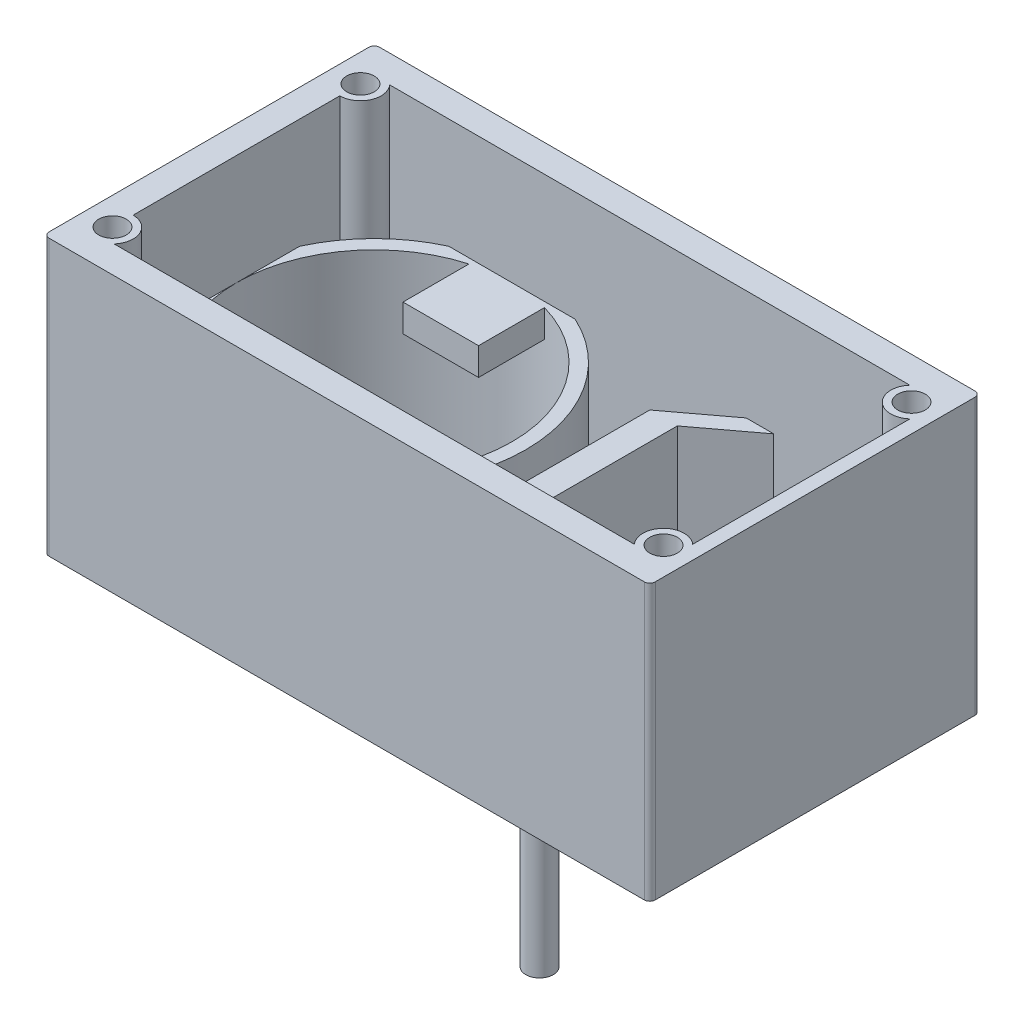
from build123d import *
from build123d.topology import SkipClean

# Parameters (mm, degrees)
SKETCH1_W                 = 22
SKETCH1_H                 = 12
BOSS_EXTRUDE1_DEPTH       = 10
SKETCH2_W                 = 20.5
SKETCH2_H                 = 10
CUT_EXTRUDE1_DEPTH        = 9
FILLET1_R                 = 0.2
SKETCH3_R                 = 5
CUT_EXTRUDE2_DEPTH        = 17.031219542
SKETCH4_R                 = 0.5
CUT_EXTRUDE3_DEPTH        = 17.031219542
SKETCH5_R                 = 2
CUT_EXTRUDE4_DEPTH        = 17.031219542
BOSS_EXTRUDE2_DEPTH       = 5
SKETCH9_R                 = 5.5
SKETCH9_R_2               = 5
BOSS_EXTRUDE3_DEPTH       = 5
SKETCH10_R                = 1
SKETCH10_R_2              = 0.5
BOSS_EXTRUDE4_DEPTH       = 2
BOSS_EXTRUDE6_START       = -1
SKETCH12_R                = 0.5
BOSS_EXTRUDE6_DEPTH       = 1
SKETCH13_R                = 0.75
SKETCH13_R_2              = 0.5
BOSS_EXTRUDE7_DEPTH       = 9
SKETCH14_R                = 0.5
CUT_EXTRUDE5_DEPTH        = 17.031219542
MIRROR2_COPY_1_SKETCH_R   = 0.75
MIRROR2_COPY_1_SKETCH_R_2 = 0.5
MIRROR2_COPY_1_DEPTH      = 9
MIRROR2_COPY_2_SKETCH_R   = 0.5
MIRROR2_COPY_2_DEPTH      = 17.031219542
MIRROR2_COPY_3_SKETCH_R   = 0.75
MIRROR2_COPY_3_SKETCH_R_2 = 0.5
MIRROR2_COPY_3_DEPTH      = 9
MIRROR2_COPY_4_SKETCH_R   = 0.5
MIRROR2_COPY_4_DEPTH      = 17.031219542
SKETCH15_W                = 2.741193842
SKETCH15_H                = 3.121519946
BOSS_EXTRUDE8_DEPTH       = 1
SKETCH16_R                = 0.5
BOSS_EXTRUDE9_DEPTH       = 10


with BuildPart() as part:
    # Sketch1 → Boss-Extrude1 (new body)
    with BuildSketch(Plane(origin=(0, 0, 0), x_dir=(1, 0, 0), z_dir=(0, 1, 0))):
        Rectangle(SKETCH1_W, SKETCH1_H)
    extrude(amount=BOSS_EXTRUDE1_DEPTH)

    # Sketch2 → Cut-Extrude1 (cut)
    with BuildSketch(Plane(origin=(0, 10, 0), x_dir=(1, 0, 0), z_dir=(0, 1, 0))):
        with Locations((0.25, 0)):
            Rectangle(SKETCH2_W, SKETCH2_H)
    extrude(amount=-CUT_EXTRUDE1_DEPTH, mode=Mode.SUBTRACT)

    # Fillet1
    fillet1_edges = [part.edges().sort_by_distance(p)[0] for p in [
        (-11, 5, -6),
        (11, 5, -6),
        (11, 5, 6),
        (-11, 5, 6),
    ]]
    fillet(fillet1_edges, radius=FILLET1_R)

    # Sketch3 → Cut-Extrude2 (cut, through all)
    with BuildSketch(Plane(origin=(0, 0, 0), x_dir=(-1, 0, 0), z_dir=(0, -1, 0))):
        with Locations((5, 0)):
            Circle(SKETCH3_R)
    extrude(amount=-CUT_EXTRUDE2_DEPTH, mode=Mode.SUBTRACT)

    # Sketch4 → Cut-Extrude3 (cut, through all)
    with BuildSketch(Plane(origin=(0, 0, 0), x_dir=(-1, 0, 0), z_dir=(0, -1, 0))):
        with Locations((-1, 0)):
            Circle(SKETCH4_R)
    extrude(amount=-CUT_EXTRUDE3_DEPTH, mode=Mode.SUBTRACT)

    # Sketch5 → Cut-Extrude4 (cut, through all)
    with BuildSketch(Plane(origin=(0, 0, 0), x_dir=(-1, 0, 0), z_dir=(0, -1, 0))):
        with Locations((-6.5, 0)):
            Circle(SKETCH5_R)
    extrude(amount=-CUT_EXTRUDE4_DEPTH, mode=Mode.SUBTRACT)

    # Sketch6 → Boss-Extrude2 (add)
    with BuildSketch(Plane(origin=(0, 1, 0), x_dir=(1, 0, 0), z_dir=(0, 1, 0))):
        Polygon((2.5, -3.5), (2.5, 3.5), (4.5, 5), (3.5, 5), (1.5, 3.5), (1.5, -3.5), (3.5, -5), (4.5, -5), align=None)
    extrude(amount=BOSS_EXTRUDE2_DEPTH)

    # Sketch9 → Boss-Extrude3 (add)
    with SkipClean():  # the faces are left unmerged after this step: merging them gives an invalid solid
        with BuildSketch(Plane(origin=(0, 1, 0), x_dir=(1, 0, 0), z_dir=(0, 1, 0))):
            with Locations((-5, 0)):
                Circle(SKETCH9_R)
            with Locations((-5, 0)):
                Circle(SKETCH9_R_2, mode=Mode.SUBTRACT)
        extrude(amount=BOSS_EXTRUDE3_DEPTH)

    # Sketch10 → Boss-Extrude4 (add)
    with SkipClean():  # the faces are left unmerged after this step: merging them gives an invalid solid
        with BuildSketch(Plane(origin=(0, 1, 0), x_dir=(1, 0, 0), z_dir=(0, 1, 0))):
            with Locations((1, 0)):
                Circle(SKETCH10_R)
            with Locations((1, 0)):
                Circle(SKETCH10_R_2, mode=Mode.SUBTRACT)
        extrude(amount=BOSS_EXTRUDE4_DEPTH)

    # Sketch12 → Boss-Extrude6 (add)
    with SkipClean():  # the faces are left unmerged after this step: merging them gives an invalid solid
        with BuildSketch(Plane(origin=(0, 3, 0), x_dir=(1, 0, 0), z_dir=(0, 1, 0)).offset(BOSS_EXTRUDE6_START)):
            with Locations((1, 0)):
                Circle(SKETCH12_R)
        extrude(amount=BOSS_EXTRUDE6_DEPTH)

    # Sketch13 → Boss-Extrude7 (add)
    with SkipClean():  # the faces are left unmerged after this step: merging them gives an invalid solid
        with BuildSketch(Plane(origin=(0, 1, 0), x_dir=(1, 0, 0), z_dir=(0, 1, 0))):
            with Locations((10, 4.5)):
                Circle(SKETCH13_R)
            with Locations((10, 4.5)):
                Circle(SKETCH13_R_2, mode=Mode.SUBTRACT)
        boss_extrude7 = extrude(amount=BOSS_EXTRUDE7_DEPTH)

    # Sketch14 → Cut-Extrude5 (cut, through all)
    with SkipClean():  # the faces are left unmerged after this step: merging them gives an invalid solid
        with BuildSketch(Plane(origin=(0, 0, 0), x_dir=(-1, 0, 0), z_dir=(0, -1, 0))):
            with Locations((-10, 4.5)):
                Circle(SKETCH14_R)
        cut_extrude5 = extrude(amount=-CUT_EXTRUDE5_DEPTH, mode=Mode.SUBTRACT)

    # Mirror1: Boss-Extrude7, Cut-Extrude5 across plane
    with SkipClean():  # the faces are left unmerged after this step: merging them gives an invalid solid
        add(boss_extrude7.mirror(Plane(origin=(0, 0, 0), x_dir=(0, 0, 1), z_dir=(1, 0, 0))))
        add(cut_extrude5.mirror(Plane(origin=(0, 0, 0), x_dir=(0, 0, 1), z_dir=(1, 0, 0))), mode=Mode.SUBTRACT)

    # Mirror2 copy 1 sketch → Mirror2 copy 1 (add)
    with SkipClean():  # the faces are left unmerged after this step: merging them gives an invalid solid
        with BuildSketch(Plane(origin=(0, 1, 0), x_dir=(-1, 0, 0), z_dir=(0, 1, 0))):
            with Locations((10, 4.5)):
                Circle(MIRROR2_COPY_1_SKETCH_R)
            with Locations((10, 4.5)):
                Circle(MIRROR2_COPY_1_SKETCH_R_2, mode=Mode.SUBTRACT)
        extrude(amount=MIRROR2_COPY_1_DEPTH)

    # Mirror2 copy 2 sketch → Mirror2 copy 2 (cut, through all)
    with SkipClean():  # the faces are left unmerged after this step: merging them gives an invalid solid
        with BuildSketch(Plane.XZ):
            with Locations((-10, 4.5)):
                Circle(MIRROR2_COPY_2_SKETCH_R)
        extrude(amount=-MIRROR2_COPY_2_DEPTH, mode=Mode.SUBTRACT)

    # Mirror2 copy 3 sketch → Mirror2 copy 3 (add)
    with SkipClean():  # the faces are left unmerged after this step: merging them gives an invalid solid
        with BuildSketch(Plane(origin=(0, 1, 0), x_dir=(1, 0, 0), z_dir=(0, 1, 0))):
            with Locations((10, -4.5)):
                Circle(MIRROR2_COPY_3_SKETCH_R)
            with Locations((10, -4.5)):
                Circle(MIRROR2_COPY_3_SKETCH_R_2, mode=Mode.SUBTRACT)
        extrude(amount=MIRROR2_COPY_3_DEPTH)

    # Mirror2 copy 4 sketch → Mirror2 copy 4 (cut, through all)
    with SkipClean():  # the faces are left unmerged after this step: merging them gives an invalid solid
        with BuildSketch(Plane(origin=(0, 0, 0), x_dir=(-1, 0, 0), z_dir=(0, -1, 0))):
            with Locations((-10, -4.5)):
                Circle(MIRROR2_COPY_4_SKETCH_R)
        extrude(amount=-MIRROR2_COPY_4_DEPTH, mode=Mode.SUBTRACT)

    # Sketch15 → Boss-Extrude8 (add)
    with SkipClean():  # the faces are left unmerged after this step: merging them gives an invalid solid
        with BuildSketch(Plane(origin=(0, 6, 0), x_dir=(1, 0, 0), z_dir=(0, 1, 0))):
            with Locations((-5, 3.975545746)):
                Rectangle(SKETCH15_W, SKETCH15_H)
            with Locations((-5, -3.975545746)):
                Rectangle(SKETCH15_W, SKETCH15_H)
        extrude(amount=-BOSS_EXTRUDE8_DEPTH)


with BuildPart() as body_2:
    # Sketch16 → Boss-Extrude9 (new body)
    with BuildSketch(Plane.XZ):
        with Locations((1, 0)):
            Circle(SKETCH16_R)
    extrude(amount=BOSS_EXTRUDE9_DEPTH)


solid = Compound([part.part, body_2.part])
